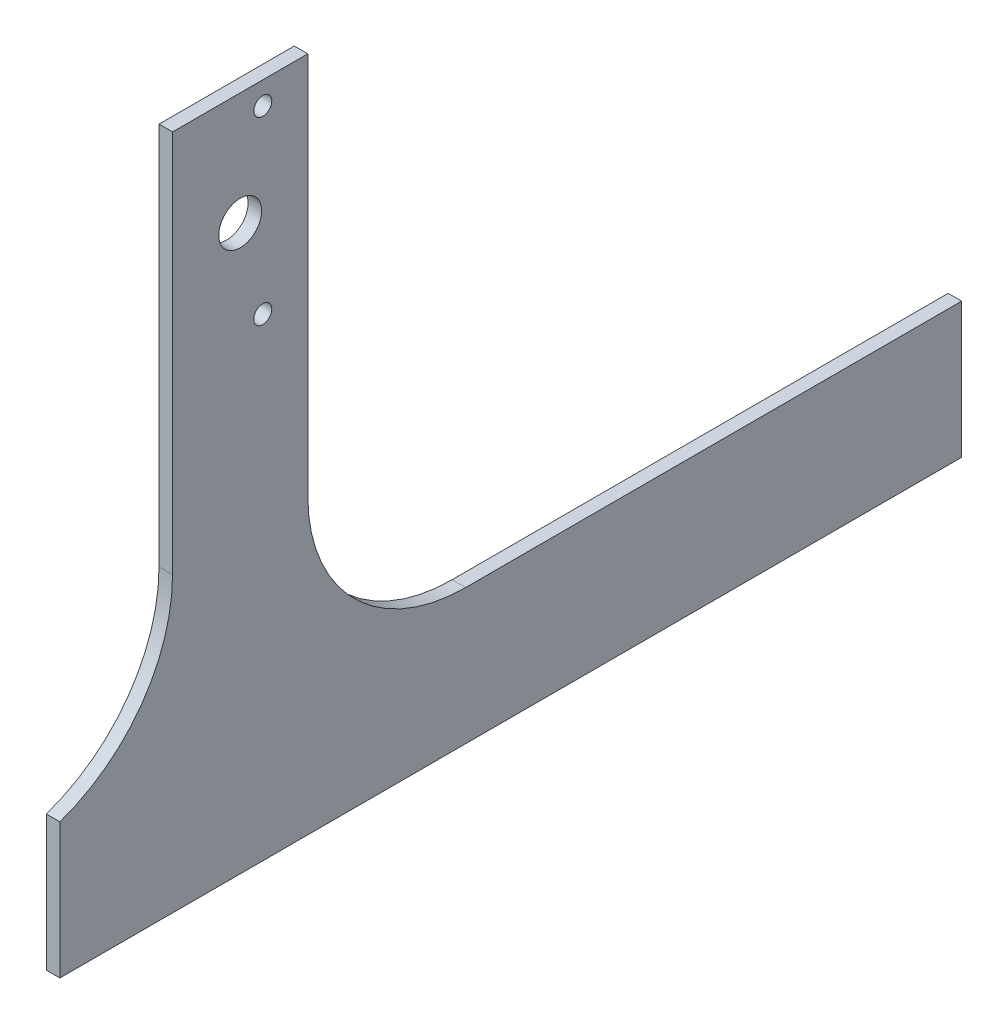
from build123d import *

# Parameters (mm, degrees)
SKETCH1_R           = 4
BOSS_EXTRUDE1_DEPTH = 6
CUT_EXTRUDE1_REACH  = 408.123
SKETCH3_R           = 9.5


with BuildPart() as part:
    # Sketch1 → Boss-Extrude1 (new body)
    with BuildSketch(Plane(origin=(0, 0, 0), x_dir=(0, 0, -1), z_dir=(1, 0, 0))):
        with BuildLine():
            Line((-80, -190), (-80, -250))
            Line((-80, -250), (320, -250))
            Line((320, -250), (320, -190))
            Line((320, -190), (100, -190))
            ThreePointArc((100, -190), (50.502525317, -169.497474683), (30, -120))
            Line((30, -120), (30, 50))
            Line((30, 50), (-30, 50))
            Line((-30, 50), (-30, -120.049643139))
            ThreePointArc((-30, -120.049643139), (-43.785205981, -163.041073753), (-80, -190))
        make_face()
        with Locations((10, -40)):
            Circle(SKETCH1_R, mode=Mode.SUBTRACT)
        Circle(SKETCH1_R, mode=Mode.SUBTRACT)
        with Locations((10, 40)):
            Circle(SKETCH1_R, mode=Mode.SUBTRACT)
    extrude(amount=BOSS_EXTRUDE1_DEPTH)

    # Sketch3 → Cut-Extrude1 (cut, up to next)
    with BuildSketch(Plane(origin=(6, 0, 0), x_dir=(0, 0, -1), z_dir=(1, 0, 0)), mode=Mode.PRIVATE) as cut_extrude1_sk1:
        Circle(SKETCH3_R)
    cut_extrude1_tool1 = extrude(cut_extrude1_sk1.sketch, amount=-CUT_EXTRUDE1_REACH, mode=Mode.PRIVATE) & part.part
    add(cut_extrude1_tool1.solids().sort_by_distance((6, 0, 0))[0], mode=Mode.SUBTRACT)


solid = part.part
